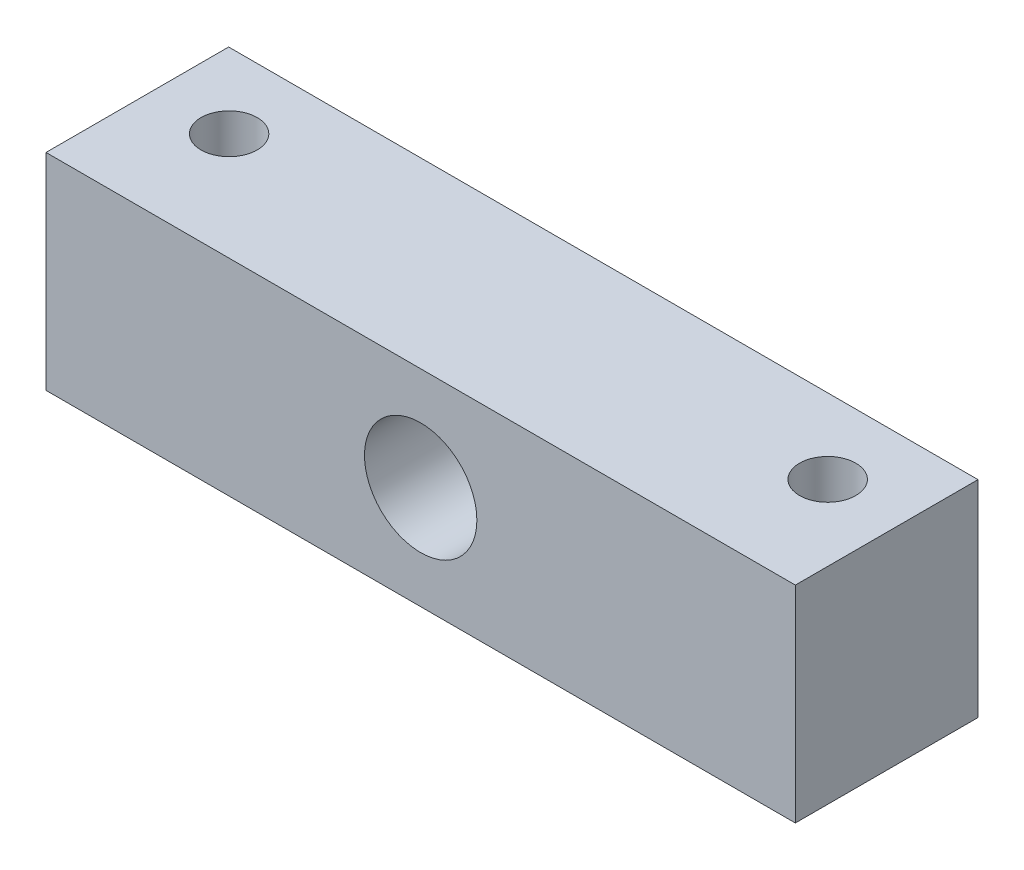
from build123d import *

# Parameters (mm, degrees)
SKETCH1_W           = 40
SKETCH1_H           = 9.75
SKETCH1_R           = 1.5
BOSS_EXTRUDE1_DEPTH = 11
CUT_EXTRUDE1_REACH  = 26.821
SKETCH2_R           = 3


with BuildPart() as part:
    # Sketch1 → Boss-Extrude1 (new body)
    with BuildSketch(Plane(origin=(0, 0, 0), x_dir=(1, 0, 0), z_dir=(0, 1, 0))):
        Rectangle(SKETCH1_W, SKETCH1_H)
        with Locations((-15.976056303, 0.875)):
            Circle(SKETCH1_R, mode=Mode.SUBTRACT)
        with Locations((15.976056303, 0.875)):
            Circle(SKETCH1_R, mode=Mode.SUBTRACT)
    extrude(amount=BOSS_EXTRUDE1_DEPTH)

    # Sketch2 → Cut-Extrude1 (cut, up to next)
    with BuildSketch(Plane.XY.offset(4.875), mode=Mode.PRIVATE) as cut_extrude1_sk1:
        with Locations((0, 5.5)):
            Circle(SKETCH2_R)
    cut_extrude1_tool1 = extrude(cut_extrude1_sk1.sketch, amount=-CUT_EXTRUDE1_REACH, mode=Mode.PRIVATE) & part.part
    add(cut_extrude1_tool1.solids().sort_by_distance((0, 5.5, 4.875))[0], mode=Mode.SUBTRACT)


solid = part.part
